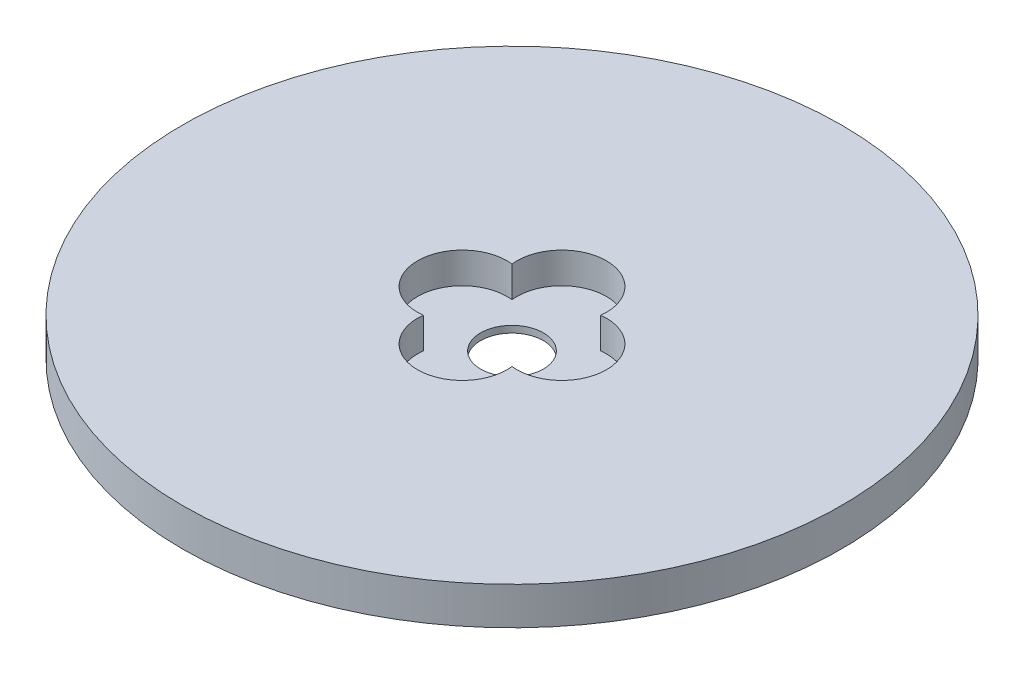
from build123d import *

# Parameters (mm, degrees)
SKETCH1_R           = 52.5
BOSS_EXTRUDE1_DEPTH = 6
SKETCH2_R           = 5
CUT_EXTRUDE1_DEPTH  = 75.488254108
SKETCH3_R           = 7.120379286
CUT_EXTRUDE2_DEPTH  = 4.924025576
CIRPATTERN1_COUNT   = 4


with BuildPart() as part:
    # Sketch1 → Boss-Extrude1 (new body)
    with BuildSketch(Plane(origin=(0, 0, 0), x_dir=(1, 0, 0), z_dir=(0, 1, 0))):
        Circle(SKETCH1_R)
    extrude(amount=BOSS_EXTRUDE1_DEPTH)

    # Sketch2 → Cut-Extrude1 (cut, through all)
    with BuildSketch(Plane(origin=(0, 0, 0), x_dir=(1, 0, 0), z_dir=(0, 1, 0))):
        Circle(SKETCH2_R)
    extrude(amount=CUT_EXTRUDE1_DEPTH, mode=Mode.SUBTRACT)

    # Sketch3 → Cut-Extrude2 (cut)
    with BuildSketch(Plane(origin=(0, 6, 0), x_dir=(1, 0, 0), z_dir=(0, 1, 0))):
        with Locations((-7.922010369, 0)):
            Circle(SKETCH3_R)
    cut_extrude2 = extrude(amount=-CUT_EXTRUDE2_DEPTH, mode=Mode.SUBTRACT)

    # CirPattern1: Cut-Extrude2 ×4 about axis
    cirpattern1_axis = Axis((0, 0, 0), (0, 1, 0))
    for i in range(1, CIRPATTERN1_COUNT):
        add(cut_extrude2.rotate(cirpattern1_axis, i * 360 / CIRPATTERN1_COUNT), mode=Mode.SUBTRACT)


solid = part.part
